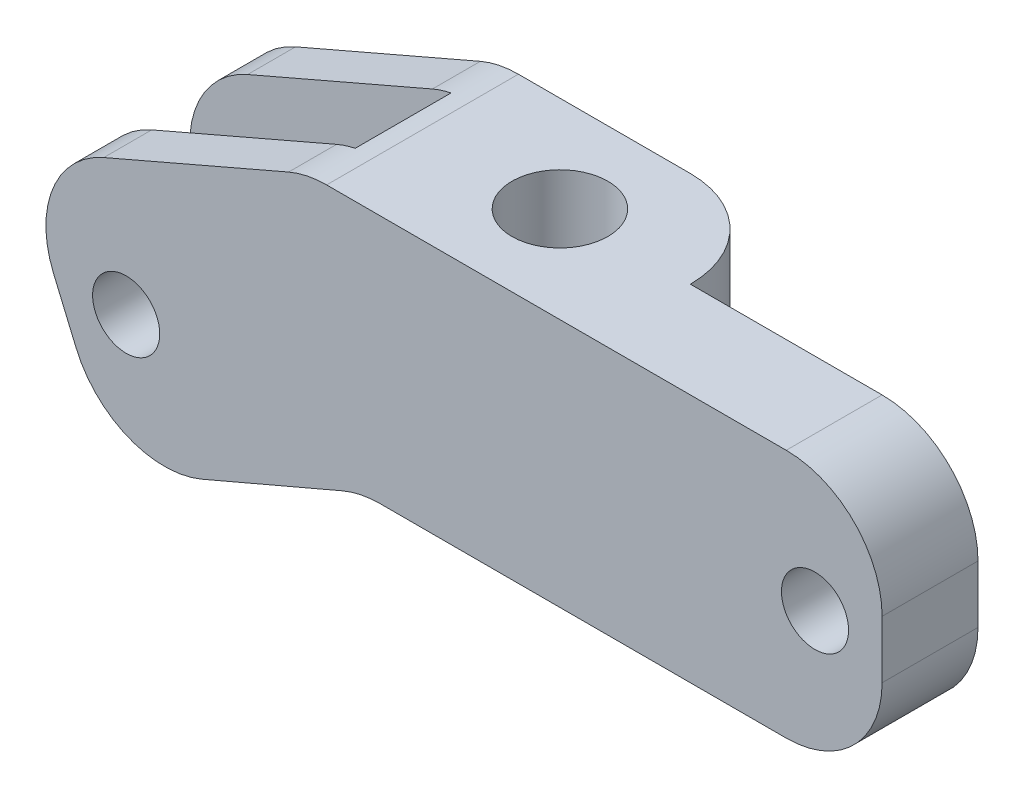
from build123d import *

# Parameters (mm, degrees)
SKETCH_1_R           = 1.75
EXTRUDE_1_DEPTH      = 10
FILLET_8_R           = 5
CUT_EXTRUDE_7_DEPTH  = 2.5
CUT_EXTRUDE_8_DEPTH  = 2.5
CUT_EXTRUDE_9_DEPTH  = 5
FILLET_10_R          = 5
SKETCH_12_R          = 2.5
CUT_EXTRUDE_10_DEPTH = 10


with BuildPart() as part:
    # 스케치1 → 보스-돌출1 (new body)
    with BuildSketch(Plane.XY):
        Polygon((-6.904227126, 6.544293027), (-22.050718655, -0.000460165), (-16.973385404, -11.96794474), (-4.104227126, -6.455706973), (23.095772874, -6.455706973), (23.095772874, 6.544293027), align=None)
        with Locations((-16.323899965, -4.537411593)):
            Circle(SKETCH_1_R, mode=Mode.SUBTRACT)
        with Locations((19.595772874, 0.044293027)):
            Circle(SKETCH_1_R, mode=Mode.SUBTRACT)
    extrude(amount=EXTRUDE_1_DEPTH)

    # 필렛8
    fillet_8_edges = [part.edges().sort_by_distance(p)[0] for p in [
        (23.095772874, -6.455706973, 5),
        (-4.104227126, -6.455706973, 5),
        (-16.973385404, -11.96794474, 5),
        (-22.050718655, -0.000460165, 5),
        (-6.904227126, 6.544293027, 5),
        (23.095772874, 6.544293027, 5),
    ]]
    fillet(fillet_8_edges, radius=FILLET_8_R)

    # 스케치9 → 컷-돌출7 (cut)
    with BuildSketch(Plane.XY.offset(5)):
        Polygon((-22.050718655, -0.000460165), (-6.904227126, 6.544293027), (-4.104227126, -6.455706973), (-16.973385404, -11.96794474), align=None)
    extrude(amount=-CUT_EXTRUDE_7_DEPTH, mode=Mode.SUBTRACT)

    # 스케치10 → 컷-돌출8 (cut)
    with BuildSketch(Plane.XY.offset(5)):
        Polygon((-22.050718655, -0.000460165), (-6.904227126, 6.544293027), (-4.104227126, -6.455706973), (-16.973385404, -11.96794474), align=None)
    extrude(amount=CUT_EXTRUDE_8_DEPTH, mode=Mode.SUBTRACT)

    # 스케치11 → 컷-돌출9 (cut)
    with BuildSketch(Plane.XY.offset(5)):
        Polygon((8.095772874, 6.544293027), (23.109867502, 6.568608602), (23.095772874, -6.455706973), (8.095772874, -6.455706973), align=None)
    extrude(amount=-CUT_EXTRUDE_9_DEPTH, mode=Mode.SUBTRACT)

    # 필렛10
    fillet_10_edges = [part.edges().sort_by_distance(p)[0] for p in [
        (8.095772874, 0.044293027, 0),
    ]]
    fillet(fillet_10_edges, radius=FILLET_10_R - 0.0001)  # a hair under: the kernel refuses the full size

    # 스케치12 → 컷-돌출10 (cut)
    with BuildSketch(Plane(origin=(0, 6.544293027, 0), x_dir=(1, 0, 0), z_dir=(0, 1, 0))):
        with Locations(Location((1.29393204, -5, 0), (0, 0, 270))):
            Circle(SKETCH_12_R)
    extrude(amount=-CUT_EXTRUDE_10_DEPTH, mode=Mode.SUBTRACT)


solid = part.part
